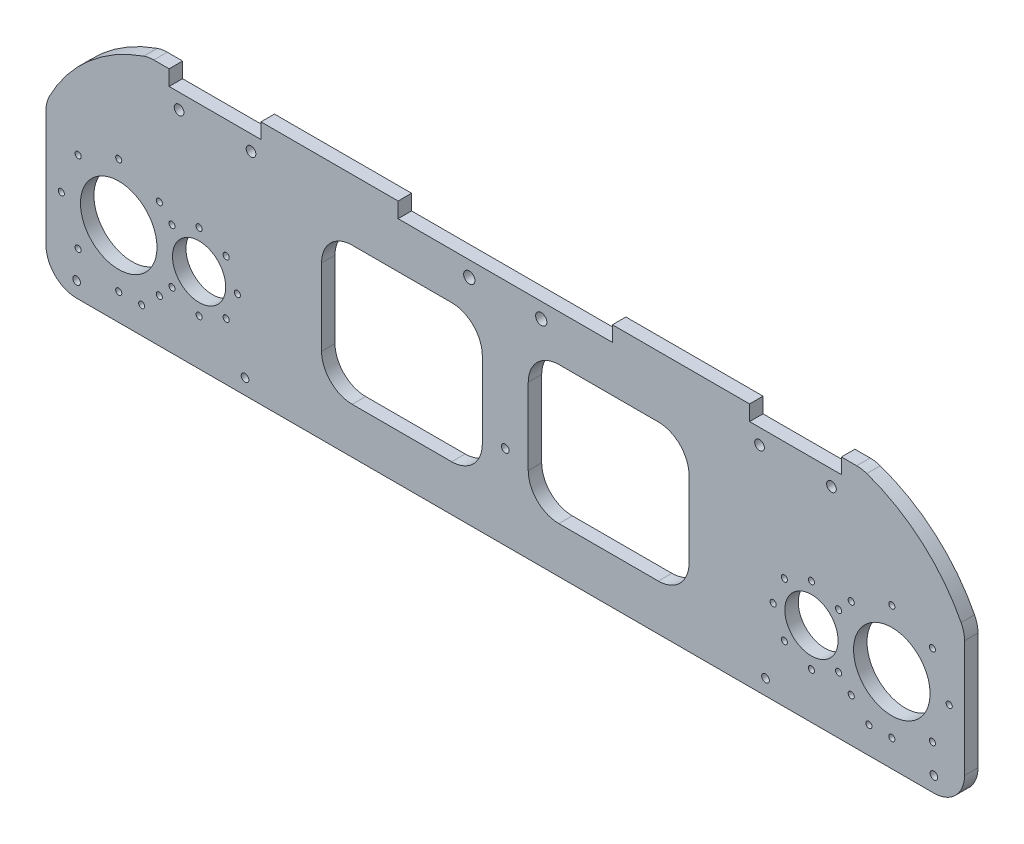
from build123d import *

# Parameters (mm, degrees)
SKETCH1_R           = 3.175
BOSS_EXTRUDE1_DEPTH = 2.794
SKETCH2_R           = 11.049
SKETCH2_R_2         = 15.875
SKETCH2_R_3         = 1.27
CUT_EXTRUDE1_DEPTH  = 202.908472752
SKETCH3_W           = 38.1
SKETCH3_H           = 6.35
SKETCH3_W_2         = 88.9
CUT_EXTRUDE4_DEPTH  = 202.908472752
CUT_EXTRUDE5_DEPTH  = 202.908472752
SKETCH5_R           = 2.003539073
SKETCH5_R_2         = 2.332520908
CUT_EXTRUDE6_DEPTH  = 202.908472752
SKETCH6_R           = 1.5875
CUT_EXTRUDE7_DEPTH  = 202.908472752
SKETCH7_R           = 1.5875
CUT_EXTRUDE8_DEPTH  = 202.908472752


with BuildPart() as part:
    # Sketch1 → Boss-Extrude1 (new, symmetric)
    with BuildSketch(Plane.XY):
        with BuildLine():
            Line((-145.783553311, 66.675), (145.783553311, 66.675))
            ThreePointArc((145.783553311, 66.675), (147.900219978, 66.497368874), (149.957676269, 65.969444444))
            ThreePointArc((149.957676269, 65.969444444), (172.789871953, 52.74760778), (189.088888889, 31.999880883))
            ThreePointArc((189.088888889, 31.999880883), (190.142181511, 29.17513943), (190.5, 26.181720723))
            Line((190.5, 26.181720723), (190.5, -22.225))
            ThreePointArc((190.5, -22.225), (186.780256121, -31.205256121), (177.8, -34.925))
            Line((177.8, -34.925), (-177.8, -34.925))
            ThreePointArc((-177.8, -34.925), (-186.780256121, -31.205256121), (-190.5, -22.225))
            Line((-190.5, -22.225), (-190.5, 26.181720723))
            ThreePointArc((-190.5, 26.181720723), (-190.142181511, 29.17513943), (-189.088888889, 31.999880883))
            ThreePointArc((-189.088888889, 31.999880883), (-172.789871953, 52.74760778), (-149.957676269, 65.969444444))
            ThreePointArc((-149.957676269, 65.969444444), (-147.900219978, 66.497368874), (-145.783553311, 66.675))
        make_face()
        with Locations((-127, 0)):
            Circle(SKETCH1_R, mode=Mode.SUBTRACT)
        with Locations((127, 0)):
            Circle(SKETCH1_R, mode=Mode.SUBTRACT)
    extrude(amount=BOSS_EXTRUDE1_DEPTH, both=True)

    # Sketch2 → Cut-Extrude1 (cut, through all)
    with BuildSketch(Plane.XY.offset(2.794)):
        with Locations((-127, 0)):
            Circle(SKETCH2_R)
        with Locations((-160.3375, 0)):
            Circle(SKETCH2_R_2)
        with Locations((-160.3375, 23.8125)):
            Circle(SKETCH2_R_3)
        with Locations((-143.499519773, 16.837980227)):
            Circle(SKETCH2_R_3)
        with Locations((-115.774679849, 11.225320151)):
            Circle(SKETCH2_R_3)
        with Locations((-150.8125, -23.8125)):
            Circle(SKETCH2_R_3)
        with Locations((-143.499519773, -16.837980227)):
            Circle(SKETCH2_R_3)
        with Locations((-160.3375, -23.8125)):
            Circle(SKETCH2_R_3)
        with Locations((-127, 15.875)):
            Circle(SKETCH2_R_3)
        with Locations((-111.125, 0)):
            Circle(SKETCH2_R_3)
        with Locations((-115.774679849, -11.225320151)):
            Circle(SKETCH2_R_3)
        with Locations((-127, -15.875)):
            Circle(SKETCH2_R_3)
        with Locations((-138.225320151, -11.225320151)):
            Circle(SKETCH2_R_3)
        with Locations((-177.175480227, -16.837980227)):
            Circle(SKETCH2_R_3)
        with Locations((177.175480227, 16.837980227)):
            Circle(SKETCH2_R_3)
        with Locations((-184.15, 0)):
            Circle(SKETCH2_R_3)
        with Locations((138.225320151, 11.225320151)):
            Circle(SKETCH2_R_3)
        with Locations((184.15, 0)):
            Circle(SKETCH2_R_3)
        with Locations((177.175480227, -16.837980227)):
            Circle(SKETCH2_R_3)
        with Locations((138.225320151, -11.225320151)):
            Circle(SKETCH2_R_3)
        with Locations((127, -15.875)):
            Circle(SKETCH2_R_3)
        with Locations((115.774679849, -11.225320151)):
            Circle(SKETCH2_R_3)
        with Locations((111.125, 0)):
            Circle(SKETCH2_R_3)
        with Locations((127, 15.875)):
            Circle(SKETCH2_R_3)
        with Locations((160.3375, -23.8125)):
            Circle(SKETCH2_R_3)
        with Locations((143.499519773, -16.837980227)):
            Circle(SKETCH2_R_3)
        with Locations((150.8125, -23.8125)):
            Circle(SKETCH2_R_3)
        with Locations((115.774679849, 11.225320151)):
            Circle(SKETCH2_R_3)
        with Locations((143.499519773, 16.837980227)):
            Circle(SKETCH2_R_3)
        with Locations((160.3375, 23.8125)):
            Circle(SKETCH2_R_3)
        with Locations((160.3375, 0)):
            Circle(SKETCH2_R_2)
        with Locations((-138.225320151, 11.225320151)):
            Circle(SKETCH2_R_3)
        with Locations((127, 0)):
            Circle(SKETCH2_R)
        with Locations((-177.175480227, 16.837980227)):
            Circle(SKETCH2_R_3)
    extrude(amount=-CUT_EXTRUDE1_DEPTH, mode=Mode.SUBTRACT)

    # Sketch3 → Cut-Extrude4 (cut, through all)
    with BuildSketch(Plane.XY.offset(2.794)):
        with Locations((-120.383553311, 63.5)):
            Rectangle(SKETCH3_W, SKETCH3_H)
        with Locations((120.383553311, 63.5)):
            Rectangle(SKETCH3_W, SKETCH3_H)
        with Locations((0, 63.5)):
            Rectangle(SKETCH3_W_2, SKETCH3_H)
    extrude(amount=-CUT_EXTRUDE4_DEPTH, mode=Mode.SUBTRACT)

    # Sketch4 → Cut-Extrude5 (cut, through all)
    with BuildSketch(Plane.XY.offset(2.794)):
        with BuildLine():
            Line((-63.5, 41.275), (-22.225, 41.275))
            ThreePointArc((-22.225, 41.275), (-13.244743879, 37.555256121), (-9.525, 28.575))
            Line((-9.525, 28.575), (-9.525, -3.175))
            ThreePointArc((-9.525, -3.175), (-13.244743879, -12.155256121), (-22.225, -15.875))
            Line((-22.225, -15.875), (-63.5, -15.875))
            ThreePointArc((-63.5, -15.875), (-72.480256121, -12.155256121), (-76.2, -3.175))
            Line((-76.2, -3.175), (-76.2, 28.575))
            ThreePointArc((-76.2, 28.575), (-72.480256121, 37.555256121), (-63.5, 41.275))
        make_face()
        with BuildLine():
            Line((76.2, 28.575), (76.2, -3.175))
            ThreePointArc((76.2, -3.175), (72.480256121, -12.155256121), (63.5, -15.875))
            Line((63.5, -15.875), (22.225, -15.875))
            ThreePointArc((22.225, -15.875), (13.244743879, -12.155256121), (9.525, -3.175))
            Line((9.525, -3.175), (9.525, 28.575))
            ThreePointArc((9.525, 28.575), (13.244743879, 37.555256121), (22.225, 41.275))
            Line((22.225, 41.275), (63.5, 41.275))
            ThreePointArc((63.5, 41.275), (72.480256121, 37.555256121), (76.2, 28.575))
        make_face()
    extrude(amount=-CUT_EXTRUDE5_DEPTH, mode=Mode.SUBTRACT)

    # Sketch5 → Cut-Extrude6 (cut, through all)
    with BuildSketch(Plane.XY.offset(2.794)):
        with Locations((-135.306053311, 53.975)):
            Circle(SKETCH5_R)
        with Locations((-105.461053311, 53.975)):
            Circle(SKETCH5_R)
        with Locations((105.461053311, 53.975)):
            Circle(SKETCH5_R)
        with Locations((135.306053311, 53.975)):
            Circle(SKETCH5_R)
        with Locations((-14.9225, 53.975)):
            Circle(SKETCH5_R_2)
        with Locations((14.9225, 53.975)):
            Circle(SKETCH5_R_2)
    extrude(amount=-CUT_EXTRUDE6_DEPTH, mode=Mode.SUBTRACT)

    # Sketch6 → Cut-Extrude7 (cut, through all)
    with BuildSketch(Plane.XY.offset(2.794)):
        with Locations((-177.8, -28.575)):
            Circle(SKETCH6_R)
        with Locations((-107.95, -28.575)):
            Circle(SKETCH6_R)
        with Locations((107.95, -28.575)):
            Circle(SKETCH6_R)
        with Locations((177.8, -28.575)):
            Circle(SKETCH6_R)
    extrude(amount=-CUT_EXTRUDE7_DEPTH, mode=Mode.SUBTRACT)

    # Sketch7 → Cut-Extrude8 (cut, through all)
    with BuildSketch(Plane.XY.offset(2.794)):
        Circle(SKETCH7_R)
    extrude(amount=-CUT_EXTRUDE8_DEPTH, mode=Mode.SUBTRACT)


solid = part.part
